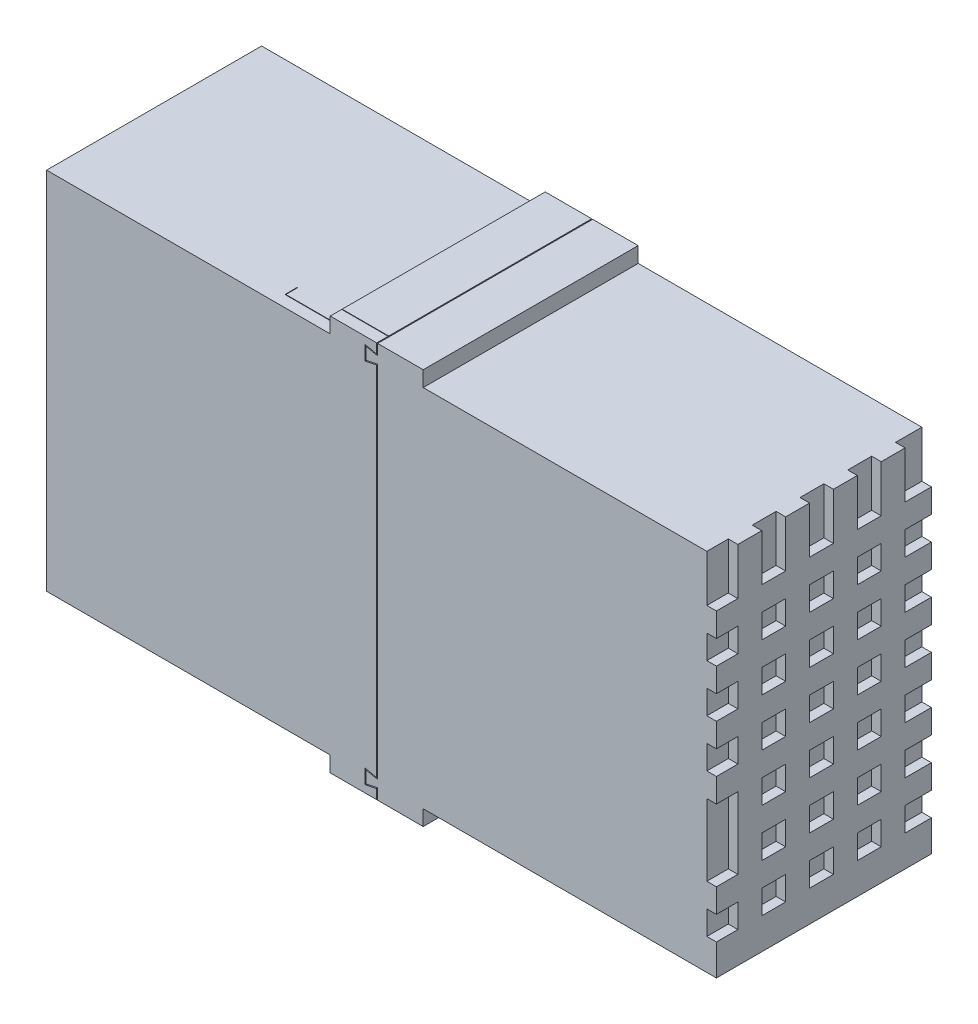
from build123d import *

# Parameters (mm, degrees)
SKETCH1_W                = 138.18931268
SKETCH1_H                = 76.341933012
SKETCH1_W_2              = 125.910200114
SKETCH1_H_2              = 69.520203808
BOSS_EXTRUDE1_DEPTH      = 40
SKETCH2_W                = 138.18931268
SKETCH2_H                = 76.341933012
SKETCH2_W_2              = 125.910200114
SKETCH2_H_2              = 69.520203808
BOSS_EXTRUDE2_DEPTH      = 5
SKETCH3_W                = 19.46061343
SKETCH3_H                = 6.466332414
BOSS_EXTRUDE3_DEPTH      = 45
CUT_EXTRUDE1_DEPTH       = 93.267945357
CUT_EXTRUDE1_DEPTH_BACK  = 93.267945357
CUT_EXTRUDE2_DEPTH       = 117.860088814
CUT_EXTRUDE2_DEPTH_BACK  = 117.860088814
SKETCH5_W                = 9.730306715
SKETCH5_H                = 0.1
CUT_EXTRUDE9_DEPTH       = 90.935386475
CUT_EXTRUDE9_DEPTH_BACK  = 90.935386475
SKETCH8_W                = 2.4
SKETCH8_H                = 69.520203808
BOSS_EXTRUDE4_DEPTH      = 21.515261332
SKETCH9_W                = 2.5
SKETCH9_H                = 69.520203808
BOSS_EXTRUDE5_DEPTH      = 21.5
SKETCH10_W               = 5
SKETCH10_H               = 5
BOSS_EXTRUDE6_DEPTH      = 2
BOSS_EXTRUDE7_DEPTH      = 4
BOSS_EXTRUDE7_DEPTH_BACK = 4
SKETCH11_W               = 30.464386999
SKETCH11_H               = 16.175649893
SKETCH11_W_2             = 28.464386999
SKETCH11_H_2             = 14.175649893
FILLET1_R                = 3
FILLET2_R                = 3


with BuildPart() as part:
    # Sketch1 → Boss-Extrude1 (new body)
    with BuildSketch(Plane.XY):
        Rectangle(SKETCH1_W, SKETCH1_H)
        Rectangle(SKETCH1_W_2, SKETCH1_H_2, mode=Mode.SUBTRACT)
    extrude(amount=BOSS_EXTRUDE1_DEPTH)

    # Sketch2 → Boss-Extrude2 (add)
    # profile 1 of 2: a face of its own
    with BuildSketch(Plane.XY.offset(40)):
        Rectangle(SKETCH2_W, SKETCH2_H)
        Rectangle(SKETCH2_W_2, SKETCH2_H_2, mode=Mode.SUBTRACT)
    # profile 2 of 2: a face of its own
    with BuildSketch(Plane.XY.offset(40)):
        Rectangle(SKETCH2_W_2, SKETCH2_H_2)
    extrude(amount=BOSS_EXTRUDE2_DEPTH)

    # Sketch3 → Boss-Extrude3 (add)
    with BuildSketch(Plane(origin=(0, 0, 0), x_dir=(-1, 0, 0), z_dir=(0, 0, -1))):
        with Locations((0, -38.170966506)):
            Rectangle(SKETCH3_W, SKETCH3_H)
        with Locations((0, 38.170966506)):
            Rectangle(SKETCH3_W, SKETCH3_H)
    extrude(amount=-BOSS_EXTRUDE3_DEPTH)

    # Sketch4 → Cut-Extrude1 (cut, two sides: drawn at the far end of the back side and taken through both)
    with BuildSketch(Plane(origin=(0, 0, 0), x_dir=(-1, 0, 0), z_dir=(0, 0, -1)).offset(-CUT_EXTRUDE1_DEPTH_BACK)):
        Polygon((0, 39.397622812), (0, 41.404132713), (-0.2, 41.404132713), (-0.2, 39.153404076), (2.291399341, 39.654369292), (2.291399341, 37.109601724), (-0.2, 37.649043075), (-0.2, 34.760101904), (0, 34.760101904), (0, 37.401104331), (2.491399341, 36.86166298), (2.491399341, 39.898588028), align=None)
        Polygon((0, -37.401104331), (0, -34.760101904), (-0.2, -34.760101904), (-0.2, -37.649043075), (2.291399341, -37.109601724), (2.291399341, -39.654369292), (-0.2, -39.153404076), (-0.2, -41.404132713), (0, -41.404132713), (0, -39.397622812), (2.491399341, -39.898588028), (2.491399341, -36.86166298), align=None)
    extrude(amount=CUT_EXTRUDE1_DEPTH + CUT_EXTRUDE1_DEPTH_BACK, mode=Mode.SUBTRACT)

    # Sketch5 → Cut-Extrude2 (cut, two sides: drawn at the far end of the back side and taken through both)
    with BuildSketch(Plane(origin=(0, 41.404132713, 0), x_dir=(1, 0, 0), z_dir=(0, 1, 0)).offset(-CUT_EXTRUDE2_DEPTH_BACK)):
        with Locations((-4.865153358, -42.55)):
            Rectangle(SKETCH5_W, SKETCH5_H)
        Polygon((-9.730306715, -42.6), (-9.730306715, -42.5), (-21.515261332, -42.5), (-21.515261332, -40), (-21.615261332, -40), (-21.615261332, -42.5), (-21.615261332, -42.6), align=None)
    extrude(amount=CUT_EXTRUDE2_DEPTH + CUT_EXTRUDE2_DEPTH_BACK, mode=Mode.SUBTRACT)

    # Sketch7 → Cut-Extrude9 (cut, two sides: drawn at the far end of the back side and taken through both)
    with BuildSketch(Plane(origin=(0, 0, 40), x_dir=(-1, 0, 0), z_dir=(0, 0, -1)).offset(-CUT_EXTRUDE9_DEPTH_BACK)):
        Polygon((-0.2, 34.760101904), (-0.2, -34.760101904), (0, -34.760101904), (21.515261332, -34.760101904), (21.515261332, 34.760101904), (0, 34.760101904), align=None)
    extrude(amount=CUT_EXTRUDE9_DEPTH + CUT_EXTRUDE9_DEPTH_BACK, mode=Mode.SUBTRACT)


with BuildPart() as cut_extrude9_piece_1:
    # of the separate pieces the step leaves, piece 1, a body of its own (cut_extrude9_pieces)
    add(part.part.solids().sort_by_distance((69.09465634, -38.170966506, 0))[0])


with BuildPart() as cut_extrude9_piece_2:
    # of the separate pieces the step leaves, piece 2, a body of its own (cut_extrude9_pieces)
    add(part.part.solids().sort_by_distance((0, -37.401104331, 45))[0])


with BuildPart() as body_3:
    # Sketch8 → Boss-Extrude4 (new body)
    with BuildSketch(Plane(origin=(-21.515261332, 0, 0), x_dir=(0, 0, -1), z_dir=(1, 0, 0))):
        with Locations((-43.8, 0)):
            Rectangle(SKETCH8_W, SKETCH8_H)
    extrude(amount=BOSS_EXTRUDE4_DEPTH)


with BuildPart() as body_4:
    # Sketch9 → Boss-Extrude5 (new body)
    with BuildSketch(Plane.ZY.offset(-0.2)):
        with Locations((41.25, 0)):
            Rectangle(SKETCH9_W, SKETCH9_H)
    extrude(amount=BOSS_EXTRUDE5_DEPTH)

    # Combine2: union Cut-Extrude9 piece 1
    add(cut_extrude9_piece_1.part)

    # Sketch10 → Boss-Extrude6 (add)
    with BuildSketch(Plane(origin=(69.09465634, 0, 0), x_dir=(0, 0, -1), z_dir=(1, 0, 0))):
        Polygon((-40.505600792, 28.361423213), (-45, 28.361423213), (-45, 23.361423213), (-40.505600792, 23.361423213), (-40.505600792, 18.361423213), (-45, 18.361423213), (-45, 13.361423213), (-40.505600792, 13.361423213), (-40.505600792, 8.361423213), (-45, 8.361423213), (-45, 3.361423213), (-40.505600792, 3.361423213), (-40.505600792, -1.638576787), (-45, -1.638576787), (-45, -6.638576787), (-40.505600792, -6.638576787), (-40.505600792, -11.638576787), (-40.505600792, -16.638576787), (-40.505600792, -21.638576787), (-45, -21.638576787), (-45, -26.638576787), (-40.505600792, -26.638576787), (-40.505600792, -31.638576787), (-45, -31.638576787), (-45, -38.170966506), (-40.505600792, -38.170966506), (-35.505600792, -38.170966506), (0, -38.170966506), (0, -31.638576787), (-5.505600792, -31.638576787), (-5.505600792, -26.638576787), (0, -26.638576787), (0, -21.638576787), (-5.505600792, -21.638576787), (-5.505600792, -16.638576787), (0, -16.638576787), (0, -11.638576787), (-5.505600792, -11.638576787), (-5.505600792, -6.638576787), (0, -6.638576787), (0, -1.638576787), (-5.505600792, -1.638576787), (-5.505600792, 3.361423213), (0, 3.361423213), (0, 8.361423213), (-5.505600792, 8.361423213), (-5.505600792, 13.361423213), (0, 13.361423213), (0, 18.361423213), (-5.505600792, 18.361423213), (-5.505600792, 23.361423213), (0, 23.361423213), (0, 28.361423213), (-5.505600792, 28.361423213), (-5.505600792, 38.170966506), (-10.505600792, 38.170966506), (-10.505600792, 28.361423213), (-15.505600792, 28.361423213), (-15.505600792, 38.170966506), (-20.505600792, 38.170966506), (-20.505600792, 28.361423213), (-25.505600792, 28.361423213), (-25.505600792, 38.170966506), (-30.505600792, 38.170966506), (-30.505600792, 28.361423213), (-35.505600792, 28.361423213), (-35.505600792, 38.170966506), (-40.505600792, 38.170966506), align=None)
        with Locations((-33.005600792, -29.138576787)):
            Rectangle(SKETCH10_W, SKETCH10_H, mode=Mode.SUBTRACT)
        with Locations((-23.005600792, -29.138576787)):
            Rectangle(SKETCH10_W, SKETCH10_H, mode=Mode.SUBTRACT)
        with Locations((-33.005600792, -19.138576787)):
            Rectangle(SKETCH10_W, SKETCH10_H, mode=Mode.SUBTRACT)
        with Locations((-23.005600792, -19.138576787)):
            Rectangle(SKETCH10_W, SKETCH10_H, mode=Mode.SUBTRACT)
        with Locations((-33.005600792, -9.138576787)):
            Rectangle(SKETCH10_W, SKETCH10_H, mode=Mode.SUBTRACT)
        with Locations((-23.005600792, -9.138576787)):
            Rectangle(SKETCH10_W, SKETCH10_H, mode=Mode.SUBTRACT)
        with Locations((-13.005600792, -29.138576787)):
            Rectangle(SKETCH10_W, SKETCH10_H, mode=Mode.SUBTRACT)
        with Locations((-13.005600792, -19.138576787)):
            Rectangle(SKETCH10_W, SKETCH10_H, mode=Mode.SUBTRACT)
        with Locations((-13.005600792, -9.138576787)):
            Rectangle(SKETCH10_W, SKETCH10_H, mode=Mode.SUBTRACT)
        with Locations((-33.005600792, 0.861423213)):
            Rectangle(SKETCH10_W, SKETCH10_H, mode=Mode.SUBTRACT)
        with Locations((-23.005600792, 0.861423213)):
            Rectangle(SKETCH10_W, SKETCH10_H, mode=Mode.SUBTRACT)
        with Locations((-33.005600792, 10.861423213)):
            Rectangle(SKETCH10_W, SKETCH10_H, mode=Mode.SUBTRACT)
        with Locations((-23.005600792, 10.861423213)):
            Rectangle(SKETCH10_W, SKETCH10_H, mode=Mode.SUBTRACT)
        with Locations((-33.005600792, 20.861423213)):
            Rectangle(SKETCH10_W, SKETCH10_H, mode=Mode.SUBTRACT)
        with Locations((-23.005600792, 20.861423213)):
            Rectangle(SKETCH10_W, SKETCH10_H, mode=Mode.SUBTRACT)
        with Locations((-13.005600792, 0.861423213)):
            Rectangle(SKETCH10_W, SKETCH10_H, mode=Mode.SUBTRACT)
        with Locations((-13.005600792, 10.861423213)):
            Rectangle(SKETCH10_W, SKETCH10_H, mode=Mode.SUBTRACT)
        with Locations((-13.005600792, 20.861423213)):
            Rectangle(SKETCH10_W, SKETCH10_H, mode=Mode.SUBTRACT)
    extrude(amount=BOSS_EXTRUDE6_DEPTH)

    # Sketch11 → Boss-Extrude7 (add, two sides: drawn at the far end of the back side and taken through both)
    with BuildSketch(Plane(origin=(0, 0, 22.5), x_dir=(-1, 0, 0), z_dir=(0, 0, -1)).offset(-BOSS_EXTRUDE7_DEPTH_BACK)):
        with Locations((-39.335620135, -46.258791453)):
            Rectangle(SKETCH11_W, SKETCH11_H)
        with Locations((-39.335620135, -46.258791453)):
            Rectangle(SKETCH11_W_2, SKETCH11_H_2, mode=Mode.SUBTRACT)
    extrude(amount=BOSS_EXTRUDE7_DEPTH + BOSS_EXTRUDE7_DEPTH_BACK)

    # Fillet1
    fillet1_edges = [body_4.edges().sort_by_distance(p)[0] for p in [
        (25.103426635, -39.170966506, 22.5),
        (53.567813634, -39.170966506, 22.5),
        (53.567813634, -53.346616399, 22.5),
        (25.103426635, -53.346616399, 22.5),
    ]]
    fillet(fillet1_edges, radius=FILLET1_R)

    # Fillet2
    # the kernel refuses this fillet: 3 mm, written as the material it adds along each edge
    with BuildSketch(Plane(origin=(54.567813634, -38.170966506, 26.5), x_dir=(0, -1, 0), z_dir=(0, 0, -1))) as fillet2_piece_1:
        with BuildLine():
            CenterArc((FILLET2_R, -FILLET2_R), FILLET2_R, 90, 90)
            Line((0, -FILLET2_R), (0, 0))
            Line((0, 0), (FILLET2_R, 0))
        make_face()
    extrude(amount=8)
    with BuildSketch(Plane(origin=(24.103426635, -38.170966506, 26.5), x_dir=(0, -1, 0), z_dir=(0, 0, -1))) as fillet2_piece_2:
        with BuildLine():
            CenterArc((FILLET2_R, FILLET2_R), FILLET2_R, 180, 90)
            Line((0, FILLET2_R), (0, 0))
            Line((0, 0), (FILLET2_R, 0))
        make_face()
    extrude(amount=8)
    # the kernel refuses this fillet: 3 mm, written as the material it takes off along each edge
    with BuildSketch(Plane(origin=(24.103426635, -54.346616399, 11), x_dir=(1, 0, 0), z_dir=(0, 0, 1)), Plane(origin=(54.567813634, -54.346616399, 11), x_dir=(0, 1, 0), z_dir=(0, 0, 1))) as fillet2_2_piece_1:
        with BuildLine():
            CenterArc((FILLET2_R, FILLET2_R), FILLET2_R, 180, 90)
            Line((0, FILLET2_R), (0, 0))
            Line((0, 0), (FILLET2_R, 0))
        make_face()
    extrude(amount=23, mode=Mode.SUBTRACT)
    with BuildSketch(Plane(origin=(16.603426635, -54.346616399, 26.5), x_dir=(0, 1, 0), z_dir=(1, 0, 0))) as fillet2_2_piece_2:
        with BuildLine():
            CenterArc((FILLET2_R, -FILLET2_R), FILLET2_R, 90, 90)
            Line((0, -FILLET2_R), (0, 0))
            Line((0, 0), (FILLET2_R, 0))
        make_face()
    extrude(amount=45.464386998, mode=Mode.SUBTRACT)
    with BuildSketch(Plane(origin=(16.603426635, -54.346616399, 18.5), x_dir=(0, 1, 0), z_dir=(1, 0, 0))) as fillet2_2_piece_3:
        with BuildLine():
            CenterArc((FILLET2_R, FILLET2_R), FILLET2_R, 180, 90)
            Line((0, FILLET2_R), (0, 0))
            Line((0, 0), (FILLET2_R, 0))
        make_face()
    extrude(amount=45.464386998, mode=Mode.SUBTRACT)


with BuildPart() as cut_extrude9_piece_2_1:
    add(cut_extrude9_piece_2.part)

    # Combine1: union body 3
    add(body_3.part)


solid = Compound([body_4.part, cut_extrude9_piece_2_1.part])
